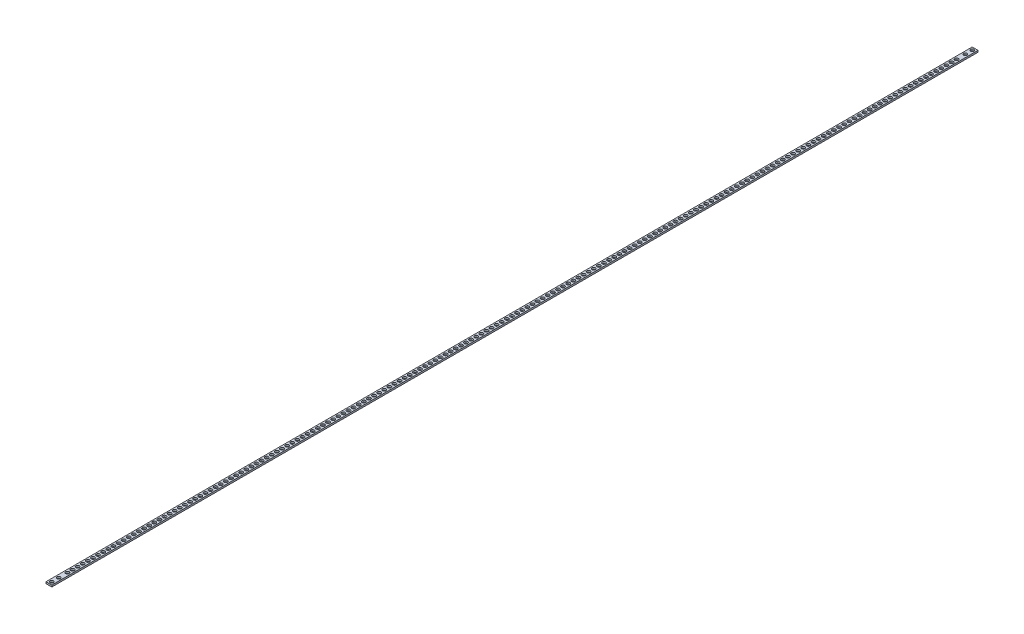
from build123d import *

# Parameters (mm, degrees)
SKETCH1_W           = 10
SKETCH1_H           = 1600
BOSS_EXTRUDE1_DEPTH = 3
LPATTERN2_COUNT     = 2
LPATTERN2_PITCH     = 12
LPATTERN3_COUNT     = 2
LPATTERN3_PITCH     = 12
LPATTERN1_COUNT     = 175
LPATTERN1_PITCH     = 8.827586207


with BuildPart() as part:
    # Sketch1 → Boss-Extrude1 (new body)
    with BuildSketch(Plane(origin=(0, 0, 0), x_dir=(1, 0, 0), z_dir=(0, 1, 0))):
        with Locations((5, 800)):
            Rectangle(SKETCH1_W, SKETCH1_H)
    extrude(amount=BOSS_EXTRUDE1_DEPTH)

    # Sketch13 → Tap Drill for M7x1.0 Tap1 (revolve, cut)
    with BuildSketch(Plane(origin=(5, 0, -5), x_dir=(0, 0, -1), z_dir=(1, 0, 0))):
        Polygon((0, 0), (0, 3), (3, 3), (3, 0.025), (3.025, 0), align=None)
    tap_drill_for_m7x1_0_tap1 = revolve(axis=Axis((5, -6.35, -5), (0, 1, 0)), mode=Mode.SUBTRACT)

    # LPattern2: Tap Drill for M7x1.0 Tap1 ×2
    with Locations(*[(0, 0, -i * LPATTERN2_PITCH) for i in range(1, LPATTERN2_COUNT)]):
        add(tap_drill_for_m7x1_0_tap1, mode=Mode.SUBTRACT)

    # Sketch15 → Tap Drill for M7x1.0 Tap2 (revolve, cut)
    with BuildSketch(Plane(origin=(5, 0, -1595), x_dir=(0, 0, -1), z_dir=(1, 0, 0))):
        Polygon((0, 0), (0, 3), (3, 3), (3, 0.025), (3.025, 0), align=None)
    tap_drill_for_m7x1_0_tap2 = revolve(axis=Axis((5, -6.35, -1595), (0, 1, 0)), mode=Mode.SUBTRACT)

    # LPattern3: Tap Drill for M7x1.0 Tap2 ×2
    with Locations(*[(0, 0, i * LPATTERN3_PITCH) for i in range(1, LPATTERN3_COUNT)]):
        add(tap_drill_for_m7x1_0_tap2, mode=Mode.SUBTRACT)

    # Sketch10 → Ø6.0mm Dowel Hole1 (revolve, cut)
    with BuildSketch(Plane(origin=(5, 3, -32), x_dir=(0, 0, 1), z_dir=(1, 0, 0))):
        Polygon((0, 0), (0, 3), (3, 3), (3, 0.025), (3.025, 0), align=None)
    f_6_0mm_dowel_hole1 = revolve(axis=Axis((5, 9.35, -32), (0, -1, 0)), mode=Mode.SUBTRACT)

    # LPattern1: Ø6.0mm Dowel Hole1 ×175
    with Locations(*[(0, 0, -i * LPATTERN1_PITCH) for i in range(1, LPATTERN1_COUNT)]):
        add(f_6_0mm_dowel_hole1, mode=Mode.SUBTRACT)


solid = part.part
